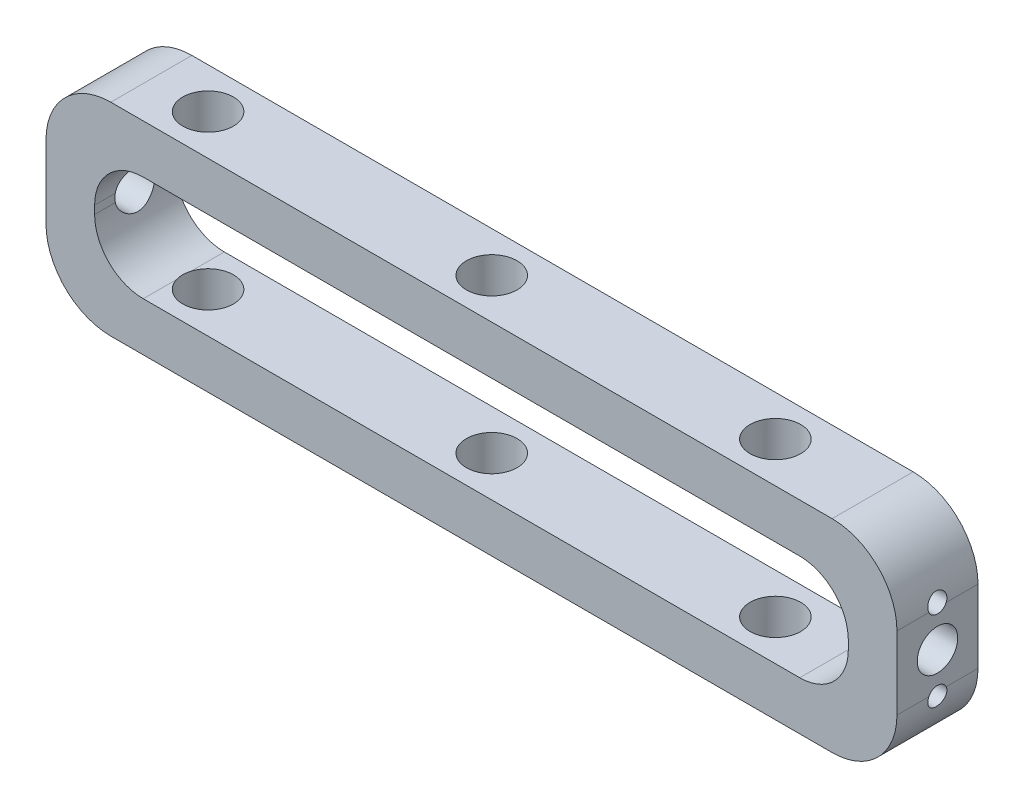
from build123d import *

# Parameters (mm, degrees)
SKETCH1_W               = 133.35
SKETCH1_H               = 31.75
SKETCH1_W_2             = 118.11
SKETCH1_H_2             = 16.51
BOSS_EXTRUDE1_DEPTH     = 6.35
FILLET2_R               = 7.62
CUT_EXTRUDE1_DEPTH      = 69.832359759
CUT_EXTRUDE1_DEPTH_BACK = 69.832359759
SKETCH2_R               = 3.175
F_3_8_16_TAPPED_HOLE1_D = 7.9375
SKETCH5_R               = 1.5
CUT_EXTRUDE2_DEPTH      = 69.832359888
FILLET3_R               = 10.16
FILLET4_R               = 10.16
FILLET5_R               = 10.16
FILLET6_R               = 10.16


with BuildPart() as part:
    # Sketch1 → Boss-Extrude1 (new, symmetric)
    with BuildSketch(Plane.XY):
        Rectangle(SKETCH1_W, SKETCH1_H)
        Rectangle(SKETCH1_W_2, SKETCH1_H_2, mode=Mode.SUBTRACT)
    extrude(amount=BOSS_EXTRUDE1_DEPTH, both=True)

    # Fillet2
    fillet2_edges = [part.edges().sort_by_distance(p)[0] for p in [
        (59.055, -8.255, 0),
        (59.055, 8.255, 0),
        (-59.055, 8.255, 0),
        (-59.055, -8.255, 0),
    ]]
    fillet(fillet2_edges, radius=FILLET2_R)

    # Sketch2 → Cut-Extrude1 (cut, two sides: drawn at the far end of the back side and taken through both)
    with BuildSketch(Plane(origin=(0, 0, 0), x_dir=(0, 0, -1), z_dir=(1, 0, 0)).offset(-CUT_EXTRUDE1_DEPTH_BACK)):
        Circle(SKETCH2_R)
    extrude(amount=CUT_EXTRUDE1_DEPTH + CUT_EXTRUDE1_DEPTH_BACK, mode=Mode.SUBTRACT)

    # 3/8-16 Tapped Hole1 (through all)
    with Locations(Plane(origin=(0, 15.875, 0), x_dir=(1, 0, 0), z_dir=(0, 1, 0))):
        with Locations((-47.625, 0), (-3.175, 0), (41.275, 0)):
            Hole(F_3_8_16_TAPPED_HOLE1_D / 2)

    # Sketch5 → Cut-Extrude2 (cut, through all)
    with BuildSketch(Plane(origin=(0, 0, 0), x_dir=(0, 0, -1), z_dir=(1, 0, 0))):
        with Locations(Location((0, -6.35, 0), (0, 0, 180))):
            Circle(SKETCH5_R)
        with Locations(Location((0, 6.35, 0), (0, 0, 180))):
            Circle(SKETCH5_R)
    extrude(amount=CUT_EXTRUDE2_DEPTH, mode=Mode.SUBTRACT)

    # Fillet3
    fillet3_edges = [part.edges().sort_by_distance(p)[0] for p in [
        (-66.675, 15.875, 0),
    ]]
    fillet(fillet3_edges, radius=FILLET3_R)

    # Fillet4
    fillet4_edges = [part.edges().sort_by_distance(p)[0] for p in [
        (-66.675, -15.875, 0),
    ]]
    fillet(fillet4_edges, radius=FILLET4_R)

    # Fillet5
    # the kernel refuses this fillet: 10.16 mm, written as the material it takes off along each edge
    with BuildSketch(Plane(origin=(66.675, -15.875, -31.75), x_dir=(-1, 0, 0), z_dir=(0, 0, 1))) as fillet5_piece_1:
        with BuildLine():
            CenterArc((FILLET5_R, -FILLET5_R), FILLET5_R, 90, 90)
            Line((0, -FILLET5_R), (0, 0))
            Line((0, 0), (FILLET5_R, 0))
        make_face()
    extrude(amount=63.5, mode=Mode.SUBTRACT)

    # Fillet6
    # the kernel refuses this fillet: 10.16 mm, written as the material it takes off along each edge
    with BuildSketch(Plane(origin=(66.675, 15.875, 31.75), x_dir=(0, -1, 0), z_dir=(0, 0, -1))) as fillet6_piece_1:
        with BuildLine():
            CenterArc((FILLET6_R, FILLET6_R), FILLET6_R, 180, 90)
            Line((0, FILLET6_R), (0, 0))
            Line((0, 0), (FILLET6_R, 0))
        make_face()
    extrude(amount=63.5, mode=Mode.SUBTRACT)


solid = part.part
